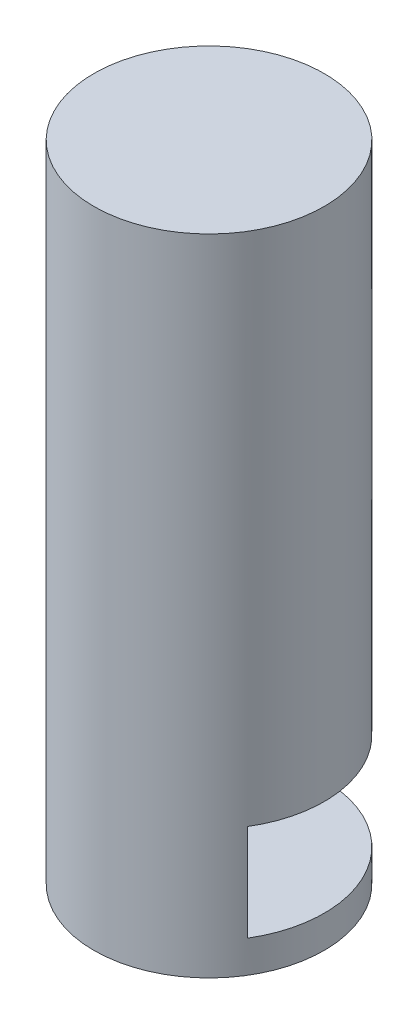
from build123d import *

# Parameters (mm, degrees)
SKETCH1_R           = 7.15
BOSS_EXTRUDE1_DEPTH = 40
SKETCH2_R           = 1
CUT_EXTRUDE1_DEPTH  = 4
SKETCH3_W           = 15.135292535
SKETCH3_H           = 11.212065391
CUT_EXTRUDE2_DEPTH  = 6


with BuildPart() as part:
    # Sketch1 → Boss-Extrude1 (new body)
    with BuildSketch(Plane(origin=(0, 0, 0), x_dir=(1, 0, 0), z_dir=(0, 1, 0))):
        Circle(SKETCH1_R)
    extrude(amount=BOSS_EXTRUDE1_DEPTH)

    # Sketch2 → Cut-Extrude1 (cut)
    with BuildSketch(Plane.XZ):
        Circle(SKETCH2_R)
    extrude(amount=-CUT_EXTRUDE1_DEPTH, mode=Mode.SUBTRACT)

    # Sketch3 → Cut-Extrude2 (cut)
    with BuildSketch(Plane(origin=(0, 2, 0), x_dir=(1, 0, 0), z_dir=(0, 1, 0))):
        with Locations((0.019914858, 1.881954138)):
            Rectangle(SKETCH3_W, SKETCH3_H)
    extrude(amount=CUT_EXTRUDE2_DEPTH, mode=Mode.SUBTRACT)


solid = part.part
